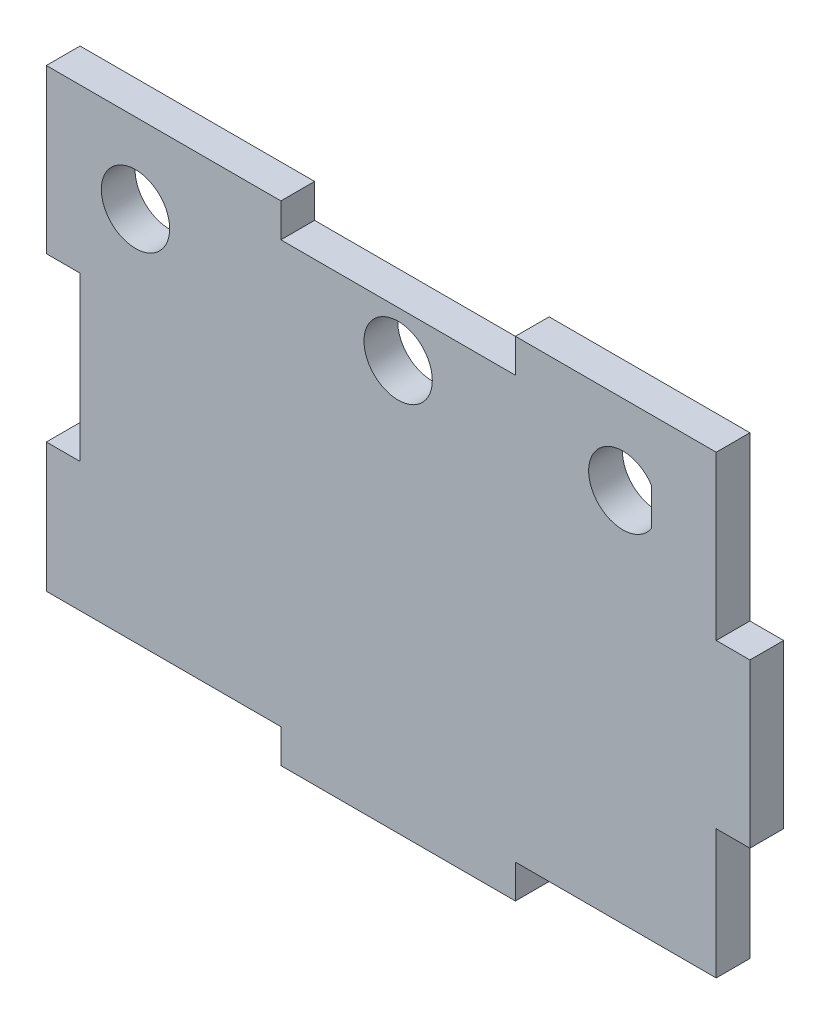
from build123d import *

# Parameters (mm, degrees)
SKETCH1_W           = 120.8024
SKETCH1_H           = 83.9724
BOSS_EXTRUDE1_DEPTH = 5.7912
SKETCH2_W           = 40.267466666
SKETCH2_H           = 5.7912
CUT_EXTRUDE1_DEPTH  = 74.788101679
SKETCH9_W           = 5.7912
SKETCH9_H           = 27.9908
CUT_EXTRUDE8_DEPTH  = 74.788101679
CAVITY1_START       = -41.9862
CAVITY1_OUTLINE_W   = 40.267466667
CAVITY1_OUTLINE_H   = 5.7912
CAVITY1_DEPTH       = 5.7912
CAVITY1_START_2     = 13.9954
CAVITY1_2_OUTLINE_W = 5.7912
CAVITY1_2_OUTLINE_H = 5.7912
CAVITY1_2_DEPTH     = 27.9908
CAVITY1_START_3     = -36.195
CAVITY1_3_OUTLINE_W = 5.7912
CAVITY1_3_OUTLINE_H = 5.7912
CAVITY1_3_DEPTH     = 22.1996
SKETCH12_R          = 5.8674
SKETCH12_W          = 10.922
SKETCH12_H          = 12.7
CUT_EXTRUDE11_DEPTH = 74.788101679


# Read off the part's stored shape, not the designer's step: Cavity1
with BuildPart() as part:
    # Sketch1 → Boss-Extrude1 (new body)
    with BuildSketch(Plane.XY):
        Rectangle(SKETCH1_W, SKETCH1_H)
    extrude(amount=BOSS_EXTRUDE1_DEPTH)

    # Sketch2 → Cut-Extrude1 (cut, through all)
    with BuildSketch(Plane.XY.offset(5.7912)):
        with Locations((0, 39.0906)):
            Rectangle(SKETCH2_W, SKETCH2_H)
    extrude(amount=-CUT_EXTRUDE1_DEPTH, mode=Mode.SUBTRACT)

    # Sketch9 → Cut-Extrude8 (cut, through all)
    with BuildSketch(Plane.XY.offset(5.7912)):
        with Locations((-57.5056, 0)):
            Rectangle(SKETCH9_W, SKETCH9_H)
    extrude(amount=-CUT_EXTRUDE8_DEPTH, mode=Mode.SUBTRACT)

    # Cavity1 outline → Cavity1 (cut)
    with BuildSketch(Plane(origin=(0, 0, 0), x_dir=(1, 0, 0), z_dir=(0, 1, 0)).offset(CAVITY1_START)):
        with Locations((40.267466666, -2.8956)):
            Rectangle(CAVITY1_OUTLINE_W, CAVITY1_OUTLINE_H)
        with Locations((-40.267466666, -2.8956)):
            Rectangle(CAVITY1_OUTLINE_W, CAVITY1_OUTLINE_H)
    extrude(amount=CAVITY1_DEPTH, mode=Mode.SUBTRACT)

    # Cavity1 2 outline → Cavity1 2 (cut)
    with BuildSketch(Plane(origin=(0, 0, 0), x_dir=(1, 0, 0), z_dir=(0, 1, 0)).offset(CAVITY1_START_2)):
        with Locations((57.5056, -2.8956)):
            Rectangle(CAVITY1_2_OUTLINE_W, CAVITY1_2_OUTLINE_H)
    extrude(amount=CAVITY1_2_DEPTH, mode=Mode.SUBTRACT)

    # Cavity1 3 outline → Cavity1 3 (cut)
    with BuildSketch(Plane(origin=(0, 0, 0), x_dir=(1, 0, 0), z_dir=(0, 1, 0)).offset(CAVITY1_START_3)):
        with Locations((57.5056, -2.8956)):
            Rectangle(CAVITY1_3_OUTLINE_W, CAVITY1_3_OUTLINE_H)
    extrude(amount=CAVITY1_3_DEPTH, mode=Mode.SUBTRACT)

    # Sketch12 → Cut-Extrude11 (cut, through all)
    with BuildSketch(Plane.XY.offset(5.7912)):
        with Locations((-45.095282218, 28.294994395)):
            Circle(SKETCH12_R)
        with Locations((0, 28.294994395)):
            Circle(SKETCH12_R)
        with Locations((-777.151378692, 665.228044766)):
            Rectangle(SKETCH12_W, SKETCH12_H)
        with BuildLine():
            Line((43.470269973, 31.538321778), (43.470269973, 25.051667013))
            ThreePointArc((43.470269973, 25.051667013), (32.713369973, 28.294994395), (43.470269973, 31.538321778))
        make_face()
    extrude(amount=-CUT_EXTRUDE11_DEPTH, mode=Mode.SUBTRACT)


solid = part.part
